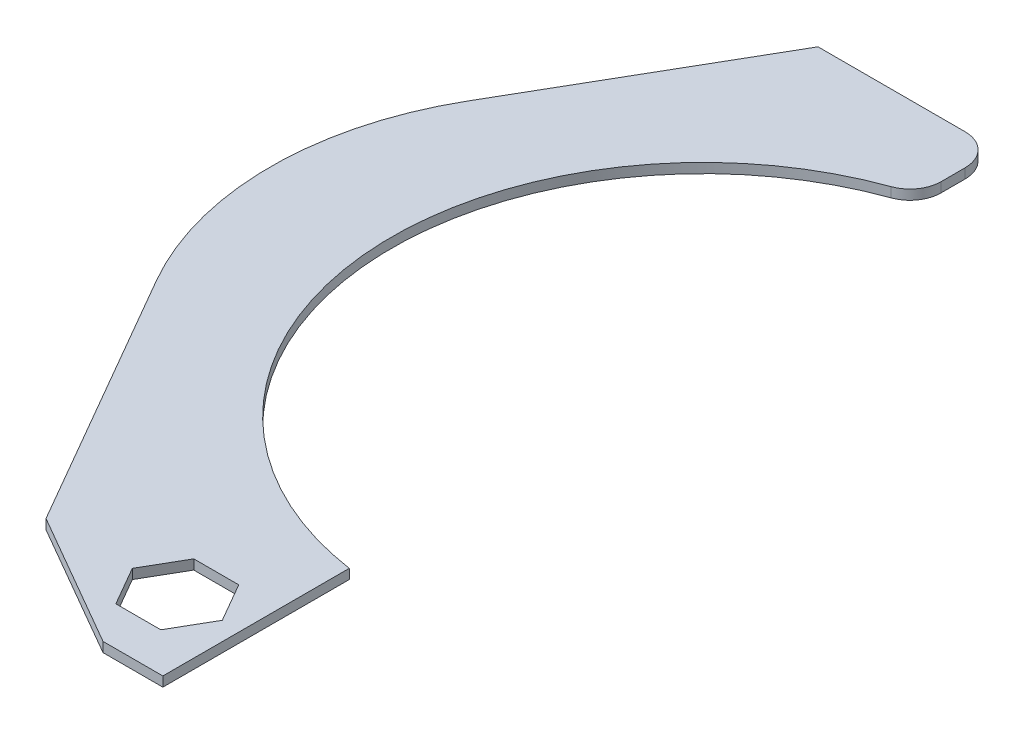
from build123d import *

# Parameters (mm, degrees)
BOSS_EXTRUDE1_DEPTH = 1.5875
CUT_EXTRUDE1_DEPTH  = 1.5875
FILLET1_R           = 5.08
CHAMFER1_SIZE2      = 21.997045256
CHAMFER1_SIZE       = 12.7
FILLET2_R           = 50.8


with BuildPart() as part:
    # Sketch1 → Boss-Extrude1 (new body)
    with BuildSketch(Plane(origin=(0, 0, 0), x_dir=(1, 0, 0), z_dir=(0, 1, 0))):
        with BuildLine():
            Line((-78.442967332, 0), (-39.221483666, -67.933602458))
            Line((-39.221483666, -67.933602458), (-39.221483666, -80.633602458))
            Line((-39.221483666, -80.633602458), (-7.471483666, -80.633602458))
            Line((-7.471483666, -80.633602458), (-7.471483666, -67.933602458))
            Line((-7.471483666, -67.933602458), (-7.471483666, -50.247556476))
            ThreePointArc((-7.471483666, -50.247556476), (-50.696097309, -3.247417072), (-13.821483666, 48.883602458))
            Line((-13.821483666, 48.883602458), (-13.821483666, 61.583602458))
            Line((-13.821483666, 61.583602458), (-42.887657875, 61.583602458))
            Line((-42.887657875, 61.583602458), (-78.442967332, 0))
        make_face()
    extrude(amount=BOSS_EXTRUDE1_DEPTH)

    # Sketch2 → Cut-Extrude1 (cut)
    with BuildSketch(Plane(origin=(0, 1.5875, 0), x_dir=(1, 0, 0), z_dir=(0, 1, 0))):
        Polygon((-10.485751581, -67.933602458), (-14.151925791, -61.583602458), (-21.484274209, -61.583602458), (-25.150448419, -67.933602458), (-21.484274209, -74.283602458), (-14.151925791, -74.283602458), align=None)
    extrude(amount=-CUT_EXTRUDE1_DEPTH, mode=Mode.SUBTRACT)

    # Fillet1
    fillet1_edges = [part.edges().sort_by_distance(p)[0] for p in [
        (-13.821483666, 0.79375, -61.583602458),
        (-13.821483666, 0.79375, -48.883602458),
    ]]
    fillet(fillet1_edges, radius=FILLET1_R)

    # Chamfer1
    chamfer1_edges = [part.edges().sort_by_distance(p)[0] for p in [
        (-39.221483666, 0.79375, 80.633602458),
    ]]
    chamfer1_side = [part.faces().sort_by_distance(p)[0] for p in [
        (-39.221483666, 0.79375, 80.379602458),
    ]]
    chamfer(chamfer1_edges, length=CHAMFER1_SIZE - 0.0001, length2=CHAMFER1_SIZE2 - 0.0001, reference=chamfer1_side[0])  # a hair under: the kernel refuses the full size

    # Fillet2
    fillet2_edges = [part.edges().sort_by_distance(p)[0] for p in [
        (-78.442967332, 0.79375, 0),
    ]]
    fillet(fillet2_edges, radius=FILLET2_R)


solid = part.part
